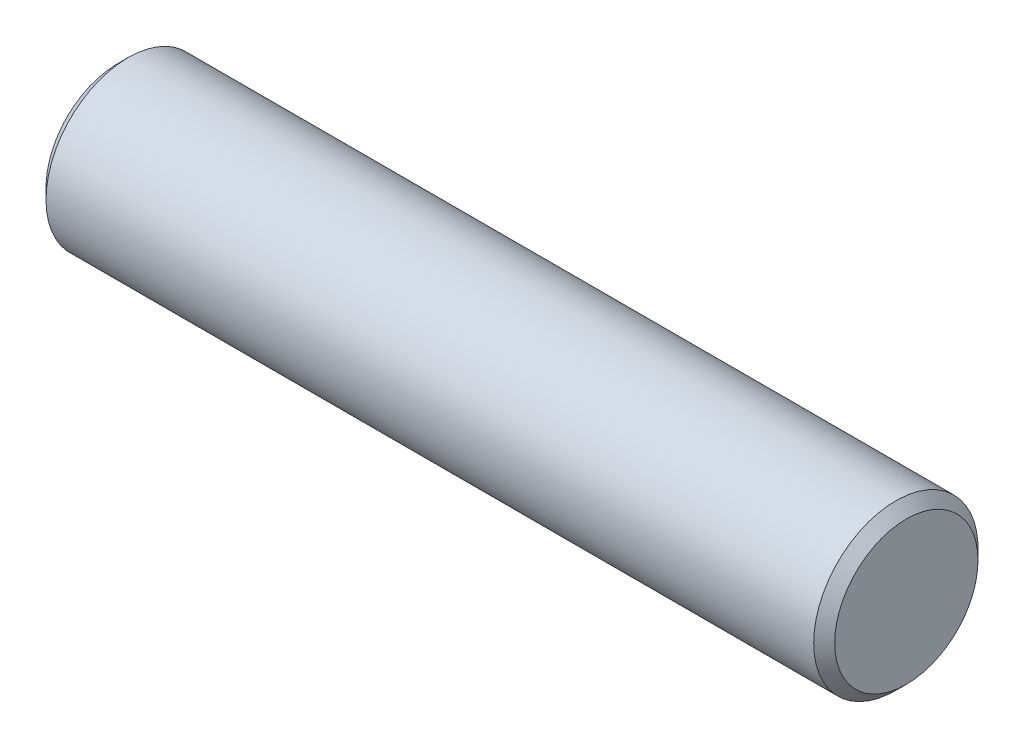
from build123d import *

# Parameters (mm, degrees)
SKETCH1_R           = 3.96875
BOSS_EXTRUDE1_DEPTH = 19.05
CHAMFER1_SIZE       = 0.508


with BuildPart() as part:
    # Sketch1 → Boss-Extrude1 (new, symmetric)
    with BuildSketch(Plane(origin=(0, 0, 0), x_dir=(0, 0, -1), z_dir=(1, 0, 0))):
        Circle(SKETCH1_R)
    extrude(amount=BOSS_EXTRUDE1_DEPTH, both=True)

    # Chamfer1
    chamfer1_edges = [part.edges().sort_by_distance(p)[0] for p in [
        (-19.05, 0, 3.96875),
        (19.05, 0, 3.96875),
    ]]
    chamfer(chamfer1_edges, length=CHAMFER1_SIZE)


solid = part.part
